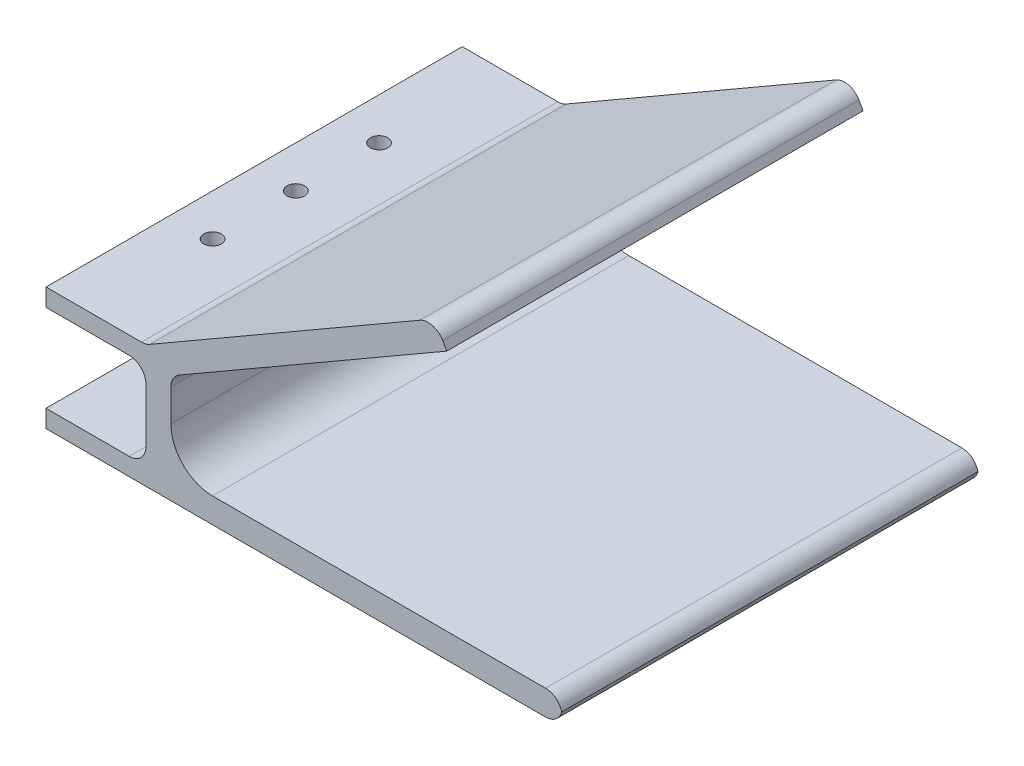
from build123d import *

# Parameters (mm, degrees)
EXTRUDE_1_DEPTH     = 100
FILLET_1_R          = 4
SKETCH_2_W          = 100
SKETCH_2_H          = 4.232050807
SKETCH_2_H_2        = 4.232050808
EXTRUDE_2_DEPTH     = 24
FILLET_2_R          = 4
FILLET_3_R          = 4
SKETCH_3_R          = 2.1
CUT_EXTRUDE_2_DEPTH = 143.468075254
FILLET_4_R          = 10


with BuildPart() as part:
    # 草图1 → 凸台-拉伸1 (new body)
    with BuildSketch(Plane.XY):
        Polygon((66.282032303, 38.267949192), (0, 0), (0, -20), (94, -20), (94, -26), (-6, -26), (-6, 3.464101615), (63.282032303, 43.464101615), align=None)
    extrude(amount=EXTRUDE_1_DEPTH)

    # 圆角1
    # the kernel refuses this fillet: 4 mm, written as the material it adds along each edge
    with BuildSketch(Plane(origin=(0, 0, 0), x_dir=(0.8660254037844385, 0.5000000000000003, 0), z_dir=(0, 0, 1))) as fillet_1_piece_1:
        with BuildLine():
            CenterArc((FILLET_1_R * 0.57735026919, -FILLET_1_R), FILLET_1_R, 90, 60)
            Line((-FILLET_1_R * 0.288675134595, -FILLET_1_R * 0.5), (0, 0))
            Line((0, 0), (FILLET_1_R * 0.57735026919, 0))
        make_face()
    extrude(amount=100)
    # the kernel refuses this fillet: 4 mm, written as the material it takes off along each edge
    with BuildSketch(Plane(origin=(94, -20, -10), x_dir=(-1, 0, 0), z_dir=(0, 0, 1)), Plane(origin=(94, -26, -10), x_dir=(0, 1, 0), z_dir=(0, 0, 1))) as fillet_1_2_piece_1:
        with BuildLine():
            CenterArc((FILLET_1_R, FILLET_1_R), FILLET_1_R, 180, 90)
            Line((0, FILLET_1_R), (0, 0))
            Line((0, 0), (FILLET_1_R, 0))
        make_face()
    extrude(amount=120, mode=Mode.SUBTRACT)
    with BuildSketch(Plane(origin=(63.282032303, 43.464101615, -10), x_dir=(0.49999999999999706, -0.8660254037844404, 0), z_dir=(0, 0, 1))) as fillet_1_2_piece_2:
        with BuildLine():
            CenterArc((FILLET_1_R, -FILLET_1_R), FILLET_1_R, 90, 90)
            Line((0, -FILLET_1_R), (0, 0))
            Line((0, 0), (FILLET_1_R, 0))
        make_face()
    extrude(amount=120, mode=Mode.SUBTRACT)

    # 草图2 → 凸台-拉伸2 (add)
    with BuildSketch(Plane.ZY.offset(6)):
        with Locations((50, 1.348076212)):
            Rectangle(SKETCH_2_W, SKETCH_2_H)
        with Locations((50, -23.883974596)):
            Rectangle(SKETCH_2_W, SKETCH_2_H_2)
    extrude(amount=EXTRUDE_2_DEPTH)

    # 圆角2
    fillet_2_edges = [part.edges().sort_by_distance(p)[0] for p in [
        (-6, -0.767949192, 50),
        (-6, -21.767949192, 50),
    ]]
    fillet(fillet_2_edges, radius=FILLET_2_R)

    # 圆角3
    fillet_3_edges = [part.edges().sort_by_distance(p)[0] for p in [
        (-6, 3.464101615, 50),
    ]]
    fillet(fillet_3_edges, radius=FILLET_3_R)

    # 草图3 → 切除-拉伸2 (cut, through all)
    with BuildSketch(Plane(origin=(0, 3.464101615, 0), x_dir=(1, 0, 0), z_dir=(0, 1, 0))):
        with Locations(Location((-20, -30, 0), (0, 0, 180))):
            Circle(SKETCH_3_R)
        with Locations(Location((-20, -50, 0), (0, 0, 180))):
            Circle(SKETCH_3_R)
        with Locations(Location((-20, -70, 0), (0, 0, 180))):
            Circle(SKETCH_3_R)
    extrude(amount=-CUT_EXTRUDE_2_DEPTH, mode=Mode.SUBTRACT)

    # 圆角4
    fillet_4_edges = [part.edges().sort_by_distance(p)[0] for p in [
        (0, -20, 50),
    ]]
    fillet(fillet_4_edges, radius=FILLET_4_R)


solid = part.part
